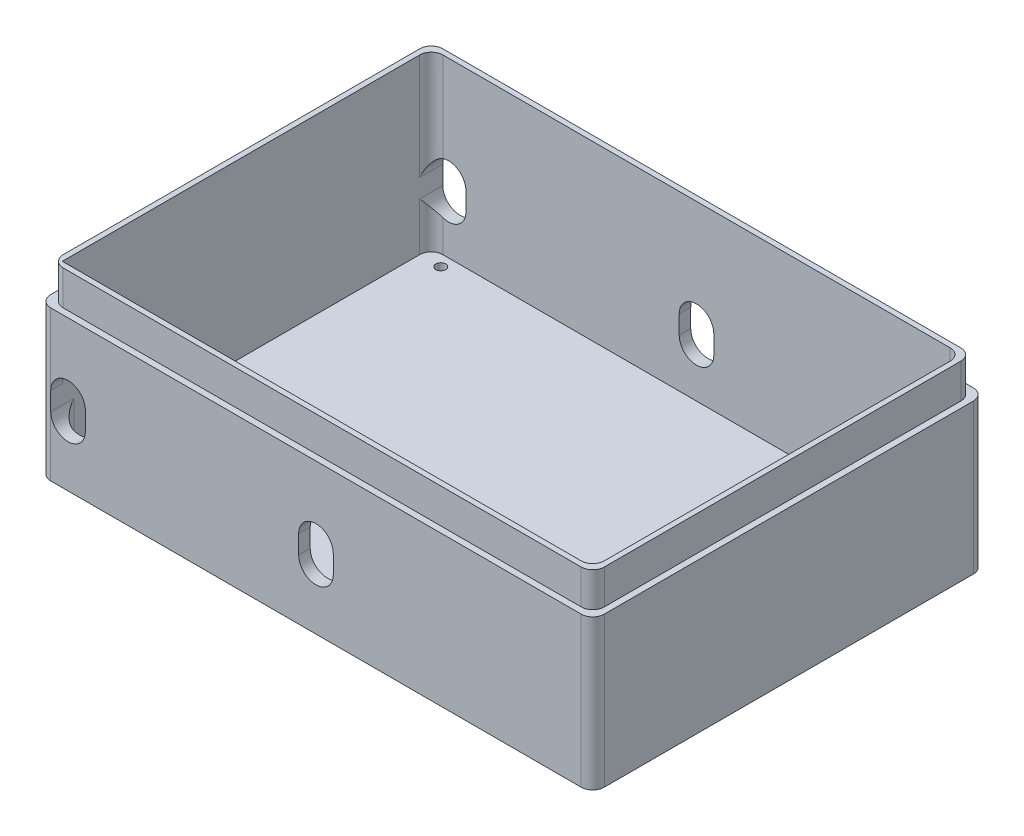
from build123d import *

# Parameters (mm, degrees)
SKETCH_1_W               = 240
SKETCH_1_H               = 170
SKETCH_1_R               = 2.15
EXTRUDE_1_DEPTH          = 80
SKETCH_2_W               = 230
SKETCH_2_H               = 160
CUT_EXTRUDE_1_DEPTH      = 75
CUT_EXTRUDE_3_DEPTH      = 220.146070008
CUT_EXTRUDE_3_DEPTH_BACK = 220.146070008
FILLET_1_R               = 5
SKETCH_12_W              = 244.6
SKETCH_12_H              = 174.6
CUT_EXTRUDE_5_DEPTH      = 15


with BuildPart() as part:
    # 草图1 → 凸台-拉伸1 (new body)
    with BuildSketch(Plane(origin=(0, 0, 0), x_dir=(1, 0, 0), z_dir=(0, 1, 0))):
        Rectangle(SKETCH_1_W, SKETCH_1_H)
        with Locations(Location((-105.882352941, 75, 0), (0, 0, 270))):
            Circle(SKETCH_1_R, mode=Mode.SUBTRACT)
        with Locations(Location((105.882352941, 75, 0), (0, 0, 270))):
            Circle(SKETCH_1_R, mode=Mode.SUBTRACT)
        with Locations(Location((105.882352941, -75, 0), (0, 0, 270))):
            Circle(SKETCH_1_R, mode=Mode.SUBTRACT)
        with Locations(Location((-105.882352941, -75, 0), (0, 0, 270))):
            Circle(SKETCH_1_R, mode=Mode.SUBTRACT)
    extrude(amount=EXTRUDE_1_DEPTH)

    # 草图2 → 切除-拉伸1 (cut)
    with BuildSketch(Plane(origin=(0, 80, 0), x_dir=(1, 0, 0), z_dir=(0, 1, 0))):
        Rectangle(SKETCH_2_W, SKETCH_2_H)
    extrude(amount=-CUT_EXTRUDE_1_DEPTH, mode=Mode.SUBTRACT)

    # 草图9 → 切除-拉伸3 (cut, two sides: drawn at the far end of the back side and taken through both)
    with BuildSketch(Plane.XY.offset(-80).offset(-CUT_EXTRUDE_3_DEPTH_BACK)):
        with BuildLine():
            Line((-115, 26), (-115, 34))
            ThreePointArc((-115, 34), (-107.5, 41.5), (-100, 34))
            Line((-100, 34), (-100, 26))
            ThreePointArc((-100, 26), (-107.5, 18.5), (-115, 26))
        make_face()
        with BuildLine():
            Line((-7.5, 26), (-7.5, 34))
            ThreePointArc((-7.5, 34), (0, 41.5), (7.5, 34))
            Line((7.5, 34), (7.5, 26))
            ThreePointArc((7.5, 26), (0, 18.5), (-7.5, 26))
        make_face()
    extrude(amount=CUT_EXTRUDE_3_DEPTH + CUT_EXTRUDE_3_DEPTH_BACK, mode=Mode.SUBTRACT)

    # 圆角1
    fillet_1_edges = [part.edges().sort_by_distance(p)[0] for p in [
        (-115, 15.5, 80),
        (-115, 15.5, -80),
        (115, 42.5, -80),
        (115, 42.5, 80),
        (-115, 57, -80),
        (120, 40, 85),
        (-120, 40, 85),
        (-120, 40, -85),
        (120, 40, -85),
    ]]
    fillet(fillet_1_edges, radius=FILLET_1_R - 0.0001)  # a hair under: the kernel refuses the full size

    # 草图12 → 切除-拉伸5 (cut)
    # profile 1 of 2: a face of its own
    with BuildSketch(Plane(origin=(0, 80, 0), x_dir=(1, 0, 0), z_dir=(0, 1, 0))):
        Rectangle(SKETCH_12_W, SKETCH_12_H)
        with BuildLine():
            Line((115, 85), (-115, 85))
            ThreePointArc((-115, 85), (-118.535533906, 83.535533906), (-120, 80))
            Line((-120, 80), (-120, -80))
            ThreePointArc((-120, -80), (-118.535533906, -83.535533906), (-115, -85))
            Line((-115, -85), (115, -85))
            ThreePointArc((115, -85), (118.535533906, -83.535533906), (120, -80))
            Line((120, -80), (120, 80))
            ThreePointArc((120, 80), (118.535533906, 83.535533906), (115, 85))
        make_face(mode=Mode.SUBTRACT)
    # profile 2 of 2: a face of its own
    with BuildSketch(Plane(origin=(0, 80, 0), x_dir=(1, 0, 0), z_dir=(0, 1, 0))):
        with BuildLine():
            ThreePointArc((120, 80), (118.535533906, 83.535533906), (115, 85))
            Line((115, 85), (-115, 85))
            ThreePointArc((-115, 85), (-118.535533906, 83.535533906), (-120, 80))
            Line((-120, 80), (-120, -80))
            ThreePointArc((-120, -80), (-118.535533906, -83.535533906), (-115, -85))
            Line((-115, -85), (115, -85))
            ThreePointArc((115, -85), (118.535533906, -83.535533906), (120, -80))
            Line((120, -80), (120, 80))
        make_face()
        with BuildLine():
            ThreePointArc((-112.3, 82.3), (-115.835533906, 80.835533906), (-117.3, 77.3))
            Line((-117.3, 77.3), (-117.3, -77.3))
            ThreePointArc((-117.3, -77.3), (-115.835533906, -80.835533906), (-112.3, -82.3))
            Line((-112.3, -82.3), (112.3, -82.3))
            ThreePointArc((112.3, -82.3), (115.835533906, -80.835533906), (117.3, -77.3))
            Line((117.3, -77.3), (117.3, 77.3))
            ThreePointArc((117.3, 77.3), (115.835533906, 80.835533906), (112.3, 82.3))
            Line((112.3, 82.3), (-112.3, 82.3))
        make_face(mode=Mode.SUBTRACT)
    extrude(amount=-CUT_EXTRUDE_5_DEPTH, mode=Mode.SUBTRACT)


solid = part.part
